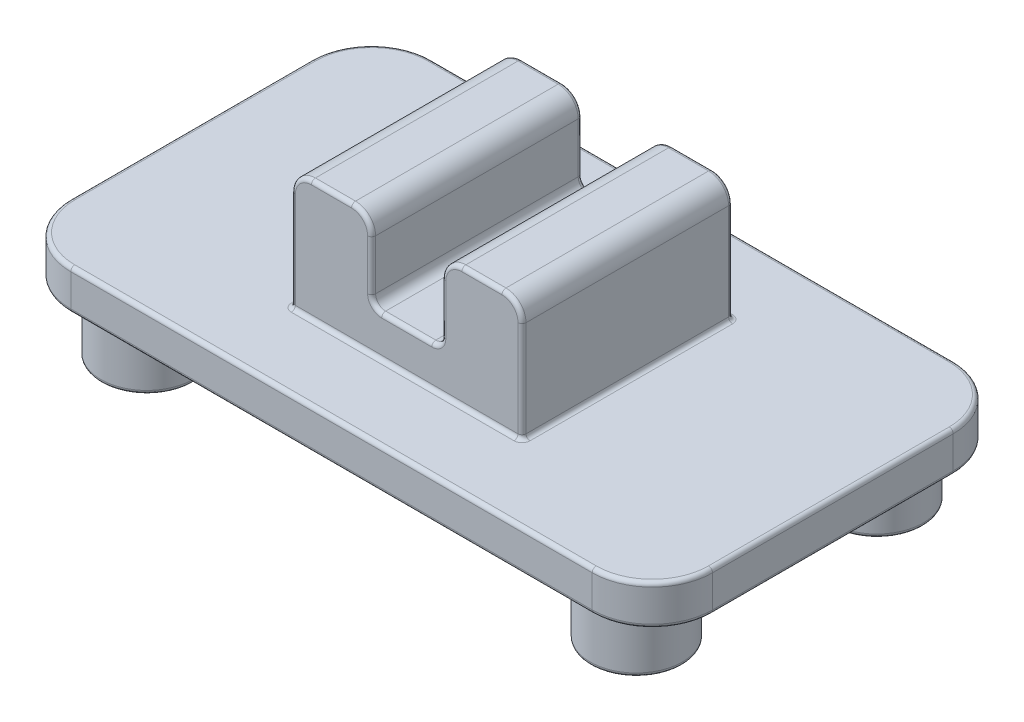
from build123d import *

# Parameters (mm, degrees)
SKETCH2_W           = 16
SKETCH2_H           = 9
BOSS_EXTRUDE1_DEPTH = 1
SKETCH3_R           = 1.15
SKETCH3_R_2         = 3
SKETCH3_R_3         = 1.5
BOSS_EXTRUDE2_DEPTH = 1.5
SKETCH6_W           = 5.75
SKETCH6_H           = 5.25
BOSS_EXTRUDE3_DEPTH = 1
SKETCH7_W           = 2
SKETCH7_H           = 5.25
BOSS_EXTRUDE4_DEPTH = 2
FILLET1_R           = 0.5
FILLET2_R           = 0.25
FILLET3_R           = 1.5
FILLET4_R           = 0.1
FILLET5_R           = 0.1
FILLET6_R           = 0.1


with BuildPart() as part:
    # Sketch2 → Boss-Extrude1 (new body)
    with BuildSketch(Plane(origin=(0, 0, 0), x_dir=(1, 0, 0), z_dir=(0, 1, 0))):
        with Locations((8, 4.5)):
            Rectangle(SKETCH2_W, SKETCH2_H)
    extrude(amount=BOSS_EXTRUDE1_DEPTH)

    # Sketch3 → Boss-Extrude2 (add)
    # profile 1 of 5: a face of its own
    with BuildSketch(Plane.XZ):
        with Locations((1.9, -1.5)):
            Circle(SKETCH3_R)
    # profile 2 of 5: a face of its own
    with BuildSketch(Plane.XZ):
        with Locations((14.1, -1.5)):
            Circle(SKETCH3_R)
    # profile 3 of 5: a face of its own
    with BuildSketch(Plane.XZ):
        with Locations((14.1, -7.5)):
            Circle(SKETCH3_R)
    # profile 4 of 5: a face of its own
    with BuildSketch(Plane.XZ):
        with Locations((1.9, -7.5)):
            Circle(SKETCH3_R)
    # profile 5 of 5: a face of its own
    with BuildSketch(Plane.XZ):
        with Locations((8, -4.5)):
            Circle(SKETCH3_R_2)
        with Locations((8, -4.5)):
            Circle(SKETCH3_R_3, mode=Mode.SUBTRACT)
    extrude(amount=BOSS_EXTRUDE2_DEPTH)

    # Sketch6 → Boss-Extrude3 (add)
    with BuildSketch(Plane(origin=(0, 1, 0), x_dir=(1, 0, 0), z_dir=(0, 1, 0))):
        with Locations((8, 4.5)):
            Rectangle(SKETCH6_W, SKETCH6_H)
    extrude(amount=BOSS_EXTRUDE3_DEPTH)

    # Sketch7 → Boss-Extrude4 (add)
    with BuildSketch(Plane(origin=(0, 2, 0), x_dir=(1, 0, 0), z_dir=(0, 1, 0))):
        with Locations((6.125, 4.5)):
            Rectangle(SKETCH7_W, SKETCH7_H)
        with Locations((9.875, 4.5)):
            Rectangle(SKETCH7_W, SKETCH7_H)
    extrude(amount=BOSS_EXTRUDE4_DEPTH)

    # Fillet1
    fillet1_edges = [part.edges().sort_by_distance(p)[0] for p in [
        (10.875, 4, -4.5),
        (8.875, 4, -4.5),
        (7.125, 4, -4.5),
        (5.125, 4, -4.5),
    ]]
    fillet(fillet1_edges, radius=FILLET1_R)

    # Fillet2
    fillet2_edges = [part.edges().sort_by_distance(p)[0] for p in [
        (7.125, 2, -4.5),
        (8.875, 2, -4.5),
    ]]
    fillet(fillet2_edges, radius=FILLET2_R)

    # Fillet3
    fillet3_edges = [part.edges().sort_by_distance(p)[0] for p in [
        (16, 0.5, -9),
        (16, 0.5, 0),
        (0, 0.5, -9),
        (0, 0.5, 0),
    ]]
    fillet(fillet3_edges, radius=FILLET3_R)

    # Fillet4
    fillet4_edges = [part.edges().sort_by_distance(p)[0] for p in [
        (8, 1, -7.125),
        (0.439339828, 1, -0.439339828),
        (0, 1, -4.5),
        (0.439339828, 1, -8.560660172),
        (8, 1, -9),
        (15.560660172, 1, -8.560660172),
        (16, 1, -4.5),
        (15.560660172, 1, -0.439339828),
        (5.271446609, 3.853553391, -7.125),
        (6.125, 4, -7.125),
        (6.978553391, 3.853553391, -7.125),
        (7.125, 2.875, -7.125),
        (7.198223305, 2.073223305, -7.125),
        (8, 2, -7.125),
        (8.801776695, 2.073223305, -7.125),
        (8.875, 2.875, -7.125),
        (9.021446609, 3.853553391, -7.125),
        (9.875, 4, -7.125),
        (10.728553391, 3.853553391, -7.125),
        (12.95, -1.5, -7.5),
        (5, 0, -4.5),
        (0.439339828, 0, -8.560660172),
        (0, 0, -4.5),
        (0.439339828, 0, -0.439339828),
        (15.560660172, 0, -0.439339828),
        (16, 0, -4.5),
        (15.560660172, 0, -8.560660172),
        (8, 0, -9),
        (12.95, 0, -7.5),
        (0.75, 0, -7.5),
        (0.75, -1.5, -7.5),
        (0.75, 0, -1.5),
        (0.75, -1.5, -1.5),
        (12.95, 0, -1.5),
        (12.95, -1.5, -1.5),
        (8, 1, 0),
        (8, 0, 0),
        (5.125, 1, -4.5),
        (5.125, 2.25, -7.125),
        (10.875, 1, -4.5),
        (10.875, 2.25, -7.125),
        (8, 1, -1.875),
        (5.125, 2.25, -1.875),
        (5.271446609, 3.853553391, -1.875),
        (6.125, 4, -1.875),
        (6.978553391, 3.853553391, -1.875),
        (7.125, 2.875, -1.875),
        (7.198223305, 2.073223305, -1.875),
        (8, 2, -1.875),
        (8.801776695, 2.073223305, -1.875),
        (8.875, 2.875, -1.875),
        (9.021446609, 3.853553391, -1.875),
        (9.875, 4, -1.875),
        (10.728553391, 3.853553391, -1.875),
        (10.875, 2.25, -1.875),
        (6.5, -1.5, -4.5),
    ]]
    fillet(fillet4_edges, radius=FILLET4_R)

    # Fillet5
    fillet5_edges = [part.edges().sort_by_distance(p)[0] for p in [
        (5, -1.5, -4.5),
    ]]
    fillet(fillet5_edges, radius=FILLET5_R)

    # Fillet6
    fillet6_edges = [part.edges().sort_by_distance(p)[0] for p in [
        (6.5, 0, -4.5),
    ]]
    fillet(fillet6_edges, radius=FILLET6_R)


solid = part.part
